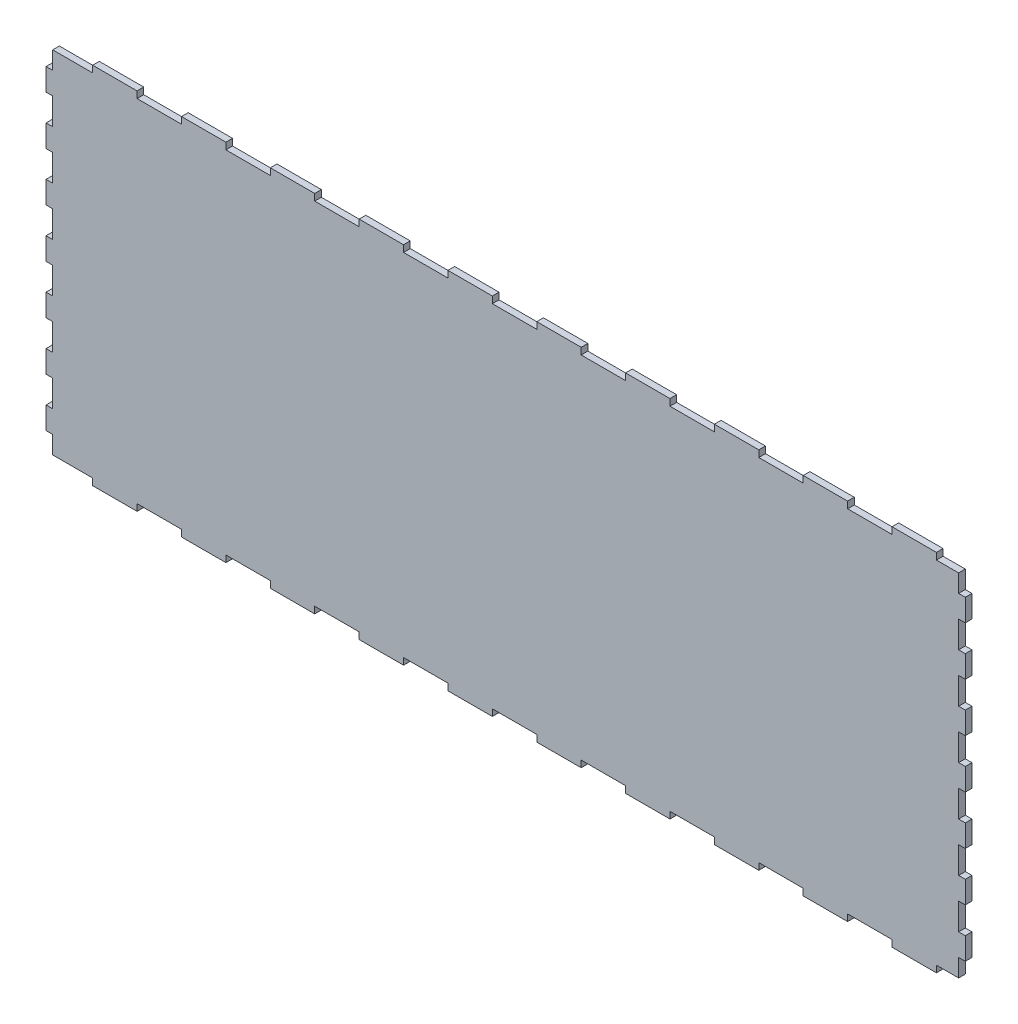
from build123d import *

# Parameters (mm, degrees)
SKETCH1_W           = 414
SKETCH1_H           = 164
BOSS_EXTRUDE1_DEPTH = 3
SKETCH2_W           = 3
SKETCH2_H           = 11
SKETCH2_H_2         = 12
CUT_EXTRUDE1_DEPTH  = 3
CUT_EXTRUDE2_DEPTH  = 3


with BuildPart() as part:
    # Sketch1 → Boss-Extrude1 (new body)
    with BuildSketch(Plane.XY.offset(152)):
        Rectangle(SKETCH1_W, SKETCH1_H)
    extrude(amount=BOSS_EXTRUDE1_DEPTH)

    # Sketch2 → Cut-Extrude1 (cut)
    with BuildSketch(Plane.ZY.offset(207)):
        with Locations((153.5, -76.5)):
            Rectangle(SKETCH2_W, SKETCH2_H)
        with Locations((153.5, 76.5)):
            Rectangle(SKETCH2_W, SKETCH2_H)
        with Locations((153.5, -55)):
            Rectangle(SKETCH2_W, SKETCH2_H_2)
        with Locations((153.5, -33)):
            Rectangle(SKETCH2_W, SKETCH2_H_2)
        with Locations((153.5, -11)):
            Rectangle(SKETCH2_W, SKETCH2_H_2)
        with Locations((153.5, 11)):
            Rectangle(SKETCH2_W, SKETCH2_H_2)
        with Locations((153.5, 33)):
            Rectangle(SKETCH2_W, SKETCH2_H_2)
        with Locations((153.5, 55)):
            Rectangle(SKETCH2_W, SKETCH2_H_2)
    cut_extrude1 = extrude(amount=-CUT_EXTRUDE1_DEPTH, mode=Mode.SUBTRACT)

    # Mirror1: Cut-Extrude1 across plane
    add(cut_extrude1.mirror(Plane(origin=(0, 0, 0), x_dir=(0, 0, 1), z_dir=(1, 0, 0))), mode=Mode.SUBTRACT)

    # Sketch3 → Cut-Extrude2 (cut)
    with BuildSketch(Plane(origin=(0, 82, 0), x_dir=(1, 0, 0), z_dir=(0, 1, 0))):
        Polygon((174, -152), (194, -152), (194, -155), (204, -155), (204, -145), (207, -145), (207, -133), (204, -133), (204, -123), (207, -123), (207, -111), (204, -111), (204, -101), (207, -101), (207, -89), (204, -89), (204, -79), (207, -79), (207, -67), (204, -67), (204, -57), (207, -57), (207, -45), (204, -45), (204, -35), (207, -35), (207, -23), (204, -23), (204, -16), (-204, -16), (-204, -23), (-207, -23), (-207, -35), (-204, -35), (-204, -45), (-207, -45), (-207, -57), (-204, -57), (-204, -67), (-207, -67), (-207, -79), (-204, -79), (-204, -89), (-207, -89), (-207, -101), (-204, -101), (-204, -111), (-207, -111), (-207, -123), (-204, -123), (-204, -133), (-207, -133), (-207, -145), (-204, -145), (-204, -155), (-186, -155), (-186, -152), (-166, -152), (-166, -155), (-146, -155), (-146, -152), (-126, -152), (-126, -155), (-106, -155), (-106, -152), (-86, -152), (-86, -155), (-66, -155), (-66, -152), (-46, -152), (-46, -155), (-26, -155), (-26, -152), (-6, -152), (-6, -155), (14, -155), (14, -152), (34, -152), (34, -155), (54, -155), (54, -152), (74, -152), (74, -155), (94, -155), (94, -152), (114, -152), (114, -155), (134, -155), (134, -152), (154, -152), (154, -155), (174, -155), align=None)
    cut_extrude2 = extrude(amount=-CUT_EXTRUDE2_DEPTH, mode=Mode.SUBTRACT)

    # Mirror2: Cut-Extrude2 across plane
    add(cut_extrude2.mirror(Plane.ZX), mode=Mode.SUBTRACT)


solid = part.part
